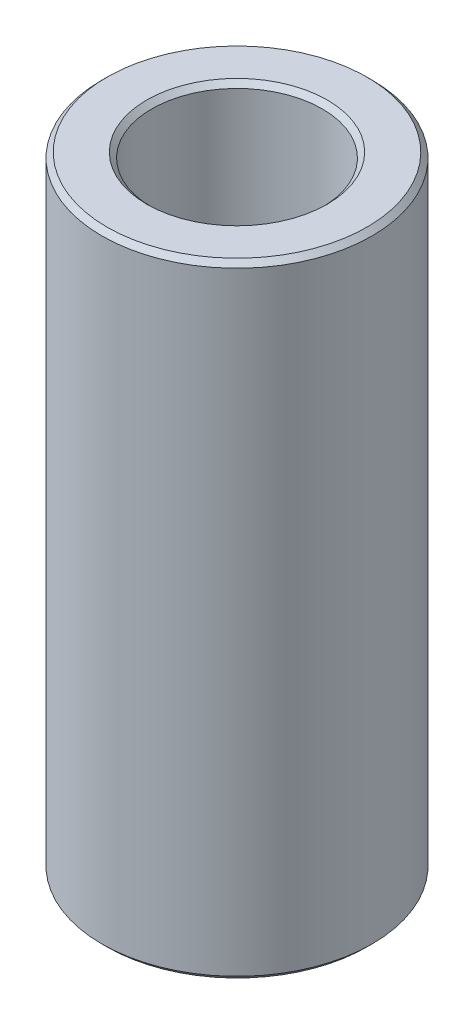
from build123d import *

# Parameters (mm, degrees)
SKETCH1_R           = 55
BOSS_EXTRUDE1_DEPTH = 253.867022828
SKETCH2_R           = 34.697250036
CUT_EXTRUDE1_DEPTH  = 266.515470886
CHAMFER1_SIZE       = 2.073786782


with BuildPart() as part:
    # Sketch1 → Boss-Extrude1 (new body)
    with BuildSketch(Plane(origin=(0, 0, 0), x_dir=(1, 0, 0), z_dir=(0, 1, 0))):
        Circle(SKETCH1_R)
    extrude(amount=BOSS_EXTRUDE1_DEPTH)

    # Sketch2 → Cut-Extrude1 (cut, through all)
    with BuildSketch(Plane(origin=(0, 0, 0), x_dir=(1, 0, 0), z_dir=(0, 1, 0))):
        Circle(SKETCH2_R)
    extrude(amount=CUT_EXTRUDE1_DEPTH, mode=Mode.SUBTRACT)

    # Chamfer1
    chamfer1_edges = [part.edges().sort_by_distance(p)[0] for p in [
        (-34.697250036, 253.867022828, 0),
        (-34.697250036, 0, 0),
        (-55, 0, 0),
        (-55, 253.867022828, 0),
    ]]
    chamfer(chamfer1_edges, length=CHAMFER1_SIZE)


solid = part.part
